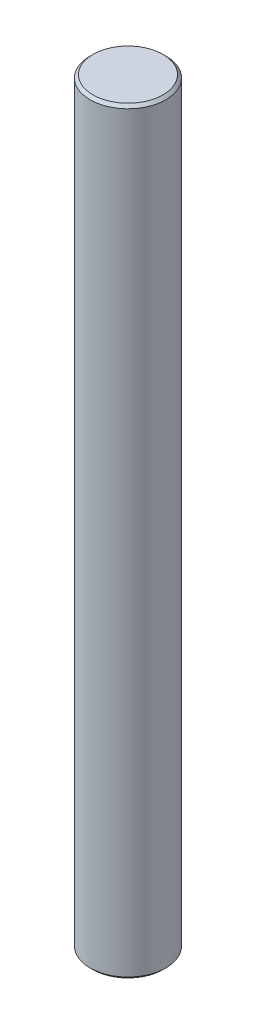
from build123d import *

# Parameters (mm, degrees)
SKETCH1_R           = 2
BOSS_EXTRUDE1_DEPTH = 40
CHAMFER1_SIZE       = 0.15


with BuildPart() as part:
    # Sketch1 → Boss-Extrude1 (new body)
    with BuildSketch(Plane(origin=(0, 0, 0), x_dir=(1, 0, 0), z_dir=(0, 1, 0))):
        Circle(SKETCH1_R)
    extrude(amount=BOSS_EXTRUDE1_DEPTH)

    # Chamfer1
    chamfer1_edges = [part.edges().sort_by_distance(p)[0] for p in [
        (-2, 0, 0),
        (-2, 40, 0),
    ]]
    chamfer(chamfer1_edges, length=CHAMFER1_SIZE)


solid = part.part
